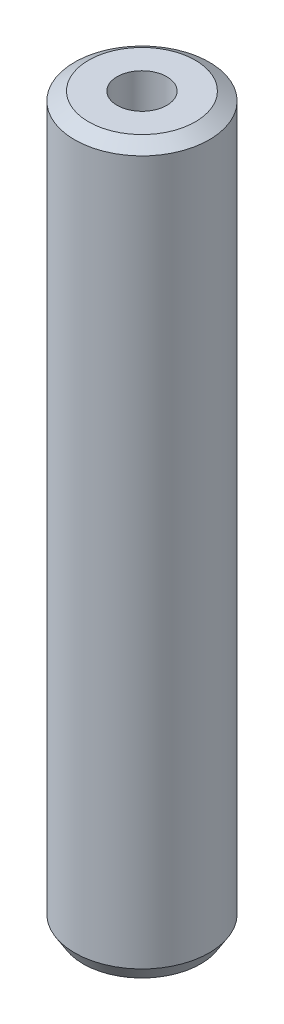
from build123d import *
from OCP.BRepFilletAPI import BRepFilletAPI_MakeChamfer

# Parameters (mm, degrees)
SKETCH1_R           = 12.5
BOSS_EXTRUDE1_DEPTH = 134.940841385
SKETCH2_R           = 4.617078724
CUT_EXTRUDE1_DEPTH  = 137.093830402
CHAMFER1_SIZE       = 1.597508314
CHAMFER1_SIZE2      = 2.586445857


with BuildPart() as part:
    # Sketch1 → Boss-Extrude1 (new body)
    with BuildSketch(Plane(origin=(0, 0, 0), x_dir=(1, 0, 0), z_dir=(0, 1, 0))):
        Circle(SKETCH1_R)
    extrude(amount=BOSS_EXTRUDE1_DEPTH)

    # Sketch2 → Cut-Extrude1 (cut, through all)
    with BuildSketch(Plane(origin=(0, 0, 0), x_dir=(1, 0, 0), z_dir=(0, 1, 0))):
        Circle(SKETCH2_R)
    extrude(amount=CUT_EXTRUDE1_DEPTH, mode=Mode.SUBTRACT)

    # Chamfer1: one chamfer whose edges measure the first distance from different faces: ONE call of the kernel's chamfer builder (chamfer() names one face for all edges)
    chamfer1_edges_1 = [part.edges().sort_by_distance(p)[0] for p in [
        (-12.5, 134.940841385, 0),
    ]]
    chamfer1_side_1 = [part.faces().sort_by_distance(p)[0] for p in [
        (-12.5, 67.470420692, 0),
    ]]
    chamfer1_edges_2 = [part.edges().sort_by_distance(p)[0] for p in [
        (-12.5, 0, 0),
    ]]
    chamfer1_side_2 = [part.faces().sort_by_distance(p)[0] for p in [
        (-12.146446609, 0, 0),
    ]]
    chamfer1 = BRepFilletAPI_MakeChamfer(part.part.solid().wrapped)
    for e in chamfer1_edges_1:
        chamfer1.Add(CHAMFER1_SIZE, CHAMFER1_SIZE2, e.wrapped, chamfer1_side_1[0].wrapped)  # the first distance lies on this face
    for e in chamfer1_edges_2:
        chamfer1.Add(CHAMFER1_SIZE, CHAMFER1_SIZE2, e.wrapped, chamfer1_side_2[0].wrapped)  # the first distance lies on this face
    add(Compound.cast(chamfer1.Shape()), mode=Mode.REPLACE)


solid = part.part
